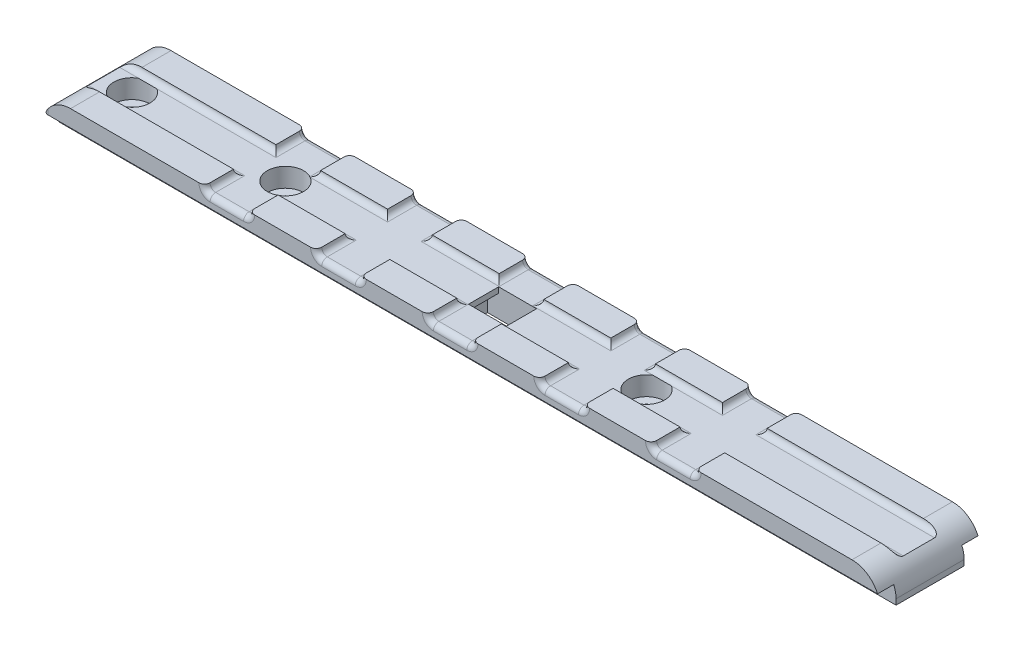
from build123d import *

# Parameters (mm, degrees)
SKETCH1_W                                    = 150
SKETCH1_H                                    = 12.2
BOSS_EXTRUDE1_DEPTH                          = 3
SKETCH2_W                                    = 150
SKETCH2_H                                    = 18
BOSS_EXTRUDE2_DEPTH                          = 2
SKETCH3_W                                    = 29
SKETCH3_H                                    = 5.2
SKETCH3_W_2                                  = 12
SKETCH3_W_3                                  = 33
BOSS_EXTRUDE3_DEPTH                          = 1
FILLET1_R                                    = 1
CBORE_FOR_M3_HEX_SOCKET_THIN_HEAD_CA_2_COUNT = 2
CBORE_FOR_M3_HEX_SOCKET_THIN_HEAD_CA_2_PITCH = 64.687824932
CBORE_FOR_M3_HEX_SOCKET_THIN_HEAD_CA_3_COUNT = 2
CBORE_FOR_M3_HEX_SOCKET_THIN_HEAD_CA_3_PITCH = 27.5
FILLET2_START                                = -36
FILLET2_DEPTH                                = 20
FILLET3_START                                = -36
FILLET3_DEPTH                                = 20
CUT_EXTRUDE1_REACH                           = 133.999
SKETCH6_W                                    = 6.8
SKETCH6_H                                    = 5.4
SKETCH7_W                                    = 18.8
SKETCH7_H                                    = 5.4
CUT_EXTRUDE2_DEPTH                           = 4


with BuildPart() as part:
    # Sketch1 → Boss-Extrude1 (new body)
    with BuildSketch(Plane(origin=(0, 0, 0), x_dir=(1, 0, 0), z_dir=(0, 1, 0))):
        with Locations((-52.188465499, 25.954582904)):
            Rectangle(SKETCH1_W, SKETCH1_H)
    extrude(amount=BOSS_EXTRUDE1_DEPTH)

    # Sketch2 → Boss-Extrude2 (add)
    with BuildSketch(Plane(origin=(0, 3, 0), x_dir=(1, 0, 0), z_dir=(0, 1, 0))):
        with Locations((-52.188465499, 25.954582904)):
            Rectangle(SKETCH2_W, SKETCH2_H)
    extrude(amount=BOSS_EXTRUDE2_DEPTH)

    # Sketch3 → Boss-Extrude3 (add)
    with BuildSketch(Plane(origin=(0, 5, 0), x_dir=(1, 0, 0), z_dir=(0, 1, 0))):
        with Locations((-112.688465499, 32.354582904)):
            Rectangle(SKETCH3_W, SKETCH3_H)
        with Locations((-84.188465499, 32.354582904)):
            Rectangle(SKETCH3_W_2, SKETCH3_H)
        with Locations((-64.188465499, 32.354582904)):
            Rectangle(SKETCH3_W_2, SKETCH3_H)
        with Locations((-44.188465499, 32.354582904)):
            Rectangle(SKETCH3_W_2, SKETCH3_H)
        with Locations((-24.188465499, 32.354582904)):
            Rectangle(SKETCH3_W_2, SKETCH3_H)
        with Locations((6.311534501, 19.554582904)):
            Rectangle(SKETCH3_W_3, SKETCH3_H)
        with Locations((6.311534501, 32.354582904)):
            Rectangle(SKETCH3_W_3, SKETCH3_H)
        with Locations((-24.188465499, 19.554582904)):
            Rectangle(SKETCH3_W_2, SKETCH3_H)
        with Locations((-44.188465499, 19.554582904)):
            Rectangle(SKETCH3_W_2, SKETCH3_H)
        with Locations((-64.188465499, 19.554582904)):
            Rectangle(SKETCH3_W_2, SKETCH3_H)
        with Locations((-84.188465499, 19.554582904)):
            Rectangle(SKETCH3_W_2, SKETCH3_H)
        with Locations((-112.688465499, 19.554582904)):
            Rectangle(SKETCH3_W, SKETCH3_H)
    extrude(amount=BOSS_EXTRUDE3_DEPTH)

    # Fillet1
    fillet1_edges = [part.edges().sort_by_distance(p)[0] for p in [
        (-112.688465499, 5, -29.754582904),
        (-98.188465499, 5, -32.354582904),
        (-90.188465499, 5, -32.354582904),
        (-84.188465499, 5, -29.754582904),
        (-78.188465499, 5, -32.354582904),
        (-70.188465499, 5, -32.354582904),
        (-64.188465499, 5, -29.754582904),
        (-58.188465499, 5, -32.354582904),
        (-50.188465499, 5, -32.354582904),
        (-44.188465499, 5, -29.754582904),
        (-38.188465499, 5, -32.354582904),
        (-30.188465499, 5, -32.354582904),
        (-24.188465499, 5, -29.754582904),
        (-18.188465499, 5, -32.354582904),
        (-10.188465499, 5, -32.354582904),
        (6.311534501, 5, -29.754582904),
        (6.311534501, 5, -22.154582904),
        (-10.188465499, 5, -19.554582904),
        (-18.188465499, 5, -19.554582904),
        (-24.188465499, 5, -22.154582904),
        (-30.188465499, 5, -19.554582904),
        (-38.188465499, 5, -19.554582904),
        (-44.188465499, 5, -22.154582904),
        (-50.188465499, 5, -19.554582904),
        (-58.188465499, 5, -19.554582904),
        (-64.188465499, 5, -22.154582904),
        (-70.188465499, 5, -19.554582904),
        (-78.188465499, 5, -19.554582904),
        (-84.188465499, 5, -22.154582904),
        (-90.188465499, 5, -19.554582904),
        (-98.188465499, 5, -19.554582904),
        (-112.688465499, 5, -22.154582904),
    ]]
    fillet(fillet1_edges, radius=FILLET1_R - 0.0001)  # a hair under: the kernel refuses the full size
    fillet1_2_edges = [part.edges().sort_by_distance(p)[0] for p in [
        (-127.188465499, 5, -25.954582904),
        (-94.188465499, 5, -34.954582904),
        (-74.188465499, 5, -34.954582904),
        (-54.188465499, 5, -34.954582904),
        (-34.188465499, 5, -34.954582904),
        (-14.188465499, 5, -34.954582904),
        (22.811534501, 5, -25.954582904),
        (-127.188465499, 4.5, -34.954582904),
        (-127.188465499, 4.5, -16.954582904),
        (-14.188465499, 5, -16.954582904),
        (-34.188465499, 5, -16.954582904),
        (-54.188465499, 5, -16.954582904),
        (-74.188465499, 5, -16.954582904),
        (-94.188465499, 5, -16.954582904),
        (-90.481329429, 5.292863929, -16.954582904),
        (-97.89560157, 5.292863929, -16.954582904),
        (-70.481329429, 5.292863929, -16.954582904),
        (-77.89560157, 5.292863929, -16.954582904),
        (-50.481329429, 5.292863929, -16.954582904),
        (-57.89560157, 5.292863929, -16.954582904),
        (-30.481329429, 5.292863929, -16.954582904),
        (-37.89560157, 5.292863929, -16.954582904),
        (-10.481329429, 5.292863929, -16.954582904),
        (-17.89560157, 5.292863929, -16.954582904),
        (22.811534501, 5.292863929, -29.461718975),
        (22.811534501, 5.292863929, -22.447446834),
        (-17.89560157, 5.292863929, -34.954582904),
        (-10.481329429, 5.292863929, -34.954582904),
        (-37.89560157, 5.292863929, -34.954582904),
        (-30.481329429, 5.292863929, -34.954582904),
        (-57.89560157, 5.292863929, -34.954582904),
        (-50.481329429, 5.292863929, -34.954582904),
        (-77.89560157, 5.292863929, -34.954582904),
        (-70.481329429, 5.292863929, -34.954582904),
        (-97.89560157, 5.292863929, -34.954582904),
        (-90.481329429, 5.292863929, -34.954582904),
        (-127.188465499, 5.292863929, -22.447446834),
        (-127.188465499, 5.292863929, -29.461718975),
    ]]
    fillet(fillet1_2_edges, radius=FILLET1_R)

    # Sketch4 → CBORE for M3 Hex Socket Thin Head Cap Screw1 (revolve, cut)
    with BuildSketch(Plane(origin=(-92.688465499, 5, -25.954582904), x_dir=(0, 0, 1), z_dir=(1, 0, 0))):
        Polygon((0, 0), (0, 16.96137699), (1.6, 16), (1.6, 3.4), (3.25, 3.4), (3.25, 0), align=None)
    cbore_for_m3_hex_socket_thin_head_cap_sc = revolve(axis=Axis((-92.688465499, 11.35, -25.954582904), (0, -1, 0)), mode=Mode.SUBTRACT)

    # CBORE for M3 Hex Socket Thin Head Ca 2: CBORE for M3 Hex Socket Thin Head Cap Screw1 ×2
    with Locations(*[(i * CBORE_FOR_M3_HEX_SOCKET_THIN_HEAD_CA_2_PITCH, 0, 0) for i in range(1, CBORE_FOR_M3_HEX_SOCKET_THIN_HEAD_CA_2_COUNT)]):
        add(cbore_for_m3_hex_socket_thin_head_cap_sc, mode=Mode.SUBTRACT)

    # CBORE for M3 Hex Socket Thin Head Ca 3: CBORE for M3 Hex Socket Thin Head Cap Screw1 ×2
    with Locations(*[(-i * CBORE_FOR_M3_HEX_SOCKET_THIN_HEAD_CA_3_PITCH, 0, 0) for i in range(1, CBORE_FOR_M3_HEX_SOCKET_THIN_HEAD_CA_3_COUNT)]):
        add(cbore_for_m3_hex_socket_thin_head_cap_sc, mode=Mode.SUBTRACT)

    # Fillet2: read off the stored shape, not the designer's step
    # Fillet2 outline → Fillet2 (cut)
    with BuildSketch(Plane.XY.offset(FILLET2_START)):
        with BuildLine():
            Line((22.811534501, 6), (17.811534501, 6))
            ThreePointArc((17.811534501, 6), (21.347068407, 4.535533906), (22.811534501, 1))
            Line((22.811534501, 1), (22.811534501, 4))
            Line((22.811534501, 4), (22.811534501, 6))
        make_face()
    extrude(amount=FILLET2_DEPTH, mode=Mode.SUBTRACT)

    # Fillet3: read off the stored shape, not the designer's step
    # Fillet3 outline → Fillet3 (cut)
    with BuildSketch(Plane.XY.offset(FILLET3_START)):
        with BuildLine():
            ThreePointArc((-127.188465499, 1), (-125.723999405, 4.535533906), (-122.188465499, 6))
            Line((-122.188465499, 6), (-127.188465499, 6))
            Line((-127.188465499, 6), (-127.188465499, 1))
        make_face()
    extrude(amount=FILLET3_DEPTH, mode=Mode.SUBTRACT)

    # Sketch6 → Cut-Extrude1 (cut, up to next)
    with BuildSketch(Plane(origin=(0, 5, 0), x_dir=(1, 0, 0), z_dir=(0, 1, 0)), mode=Mode.PRIVATE) as cut_extrude1_sk1:
        with Locations((-53.788465499, 25.954582904)):
            Rectangle(SKETCH6_W, SKETCH6_H)
    cut_extrude1_tool1 = extrude(cut_extrude1_sk1.sketch, amount=-CUT_EXTRUDE1_REACH, mode=Mode.PRIVATE) & part.part
    add(cut_extrude1_tool1.solids().sort_by_distance((-53.788465, 5, -25.954583))[0], mode=Mode.SUBTRACT)

    # Sketch7 → Cut-Extrude2 (cut)
    with BuildSketch(Plane.XZ):
        with Locations((-49.788465499, -25.954582904)):
            Rectangle(SKETCH7_W, SKETCH7_H)
    extrude(amount=-CUT_EXTRUDE2_DEPTH, mode=Mode.SUBTRACT)


solid = part.part
